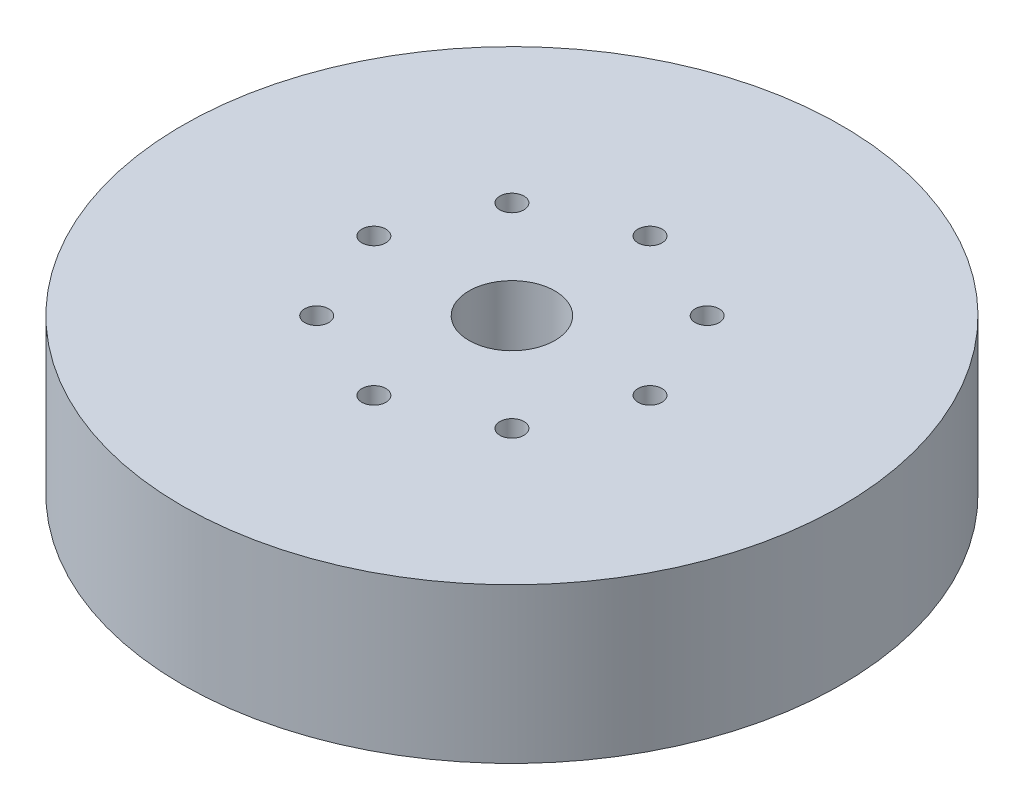
from build123d import *

# Parameters (mm, degrees)
SKETCH1_R           = 57.5
BOSS_EXTRUDE1_DEPTH = 27
SKETCH2_R           = 7.5
CUT_EXTRUDE1_DEPTH  = 86.68255365
SKETCH3_R           = 2.0950865
CUT_EXTRUDE2_DEPTH  = 21.472569349
CIRPATTERN1_COUNT   = 8


with BuildPart() as part:
    # Sketch1 → Boss-Extrude1 (new body)
    with BuildSketch(Plane(origin=(0, 0, 0), x_dir=(1, 0, 0), z_dir=(0, 1, 0))):
        Circle(SKETCH1_R)
    extrude(amount=BOSS_EXTRUDE1_DEPTH)

    # Sketch2 → Cut-Extrude1 (cut, through all)
    with BuildSketch(Plane(origin=(0, 0, 0), x_dir=(1, 0, 0), z_dir=(0, 1, 0))):
        Circle(SKETCH2_R)
    extrude(amount=CUT_EXTRUDE1_DEPTH, mode=Mode.SUBTRACT)

    # Sketch3 → Cut-Extrude2 (cut)
    with BuildSketch(Plane(origin=(0, 27, 0), x_dir=(1, 0, 0), z_dir=(0, 1, 0))):
        with Locations((-24.087177083, 0)):
            Circle(SKETCH3_R)
    cut_extrude2 = extrude(amount=-CUT_EXTRUDE2_DEPTH, mode=Mode.SUBTRACT)

    # CirPattern1: Cut-Extrude2 ×8 about axis
    cirpattern1_axis = Axis((0, 0, 0), (0, 1, 0))
    for i in range(1, CIRPATTERN1_COUNT):
        add(cut_extrude2.rotate(cirpattern1_axis, i * 360 / CIRPATTERN1_COUNT), mode=Mode.SUBTRACT)


solid = part.part
